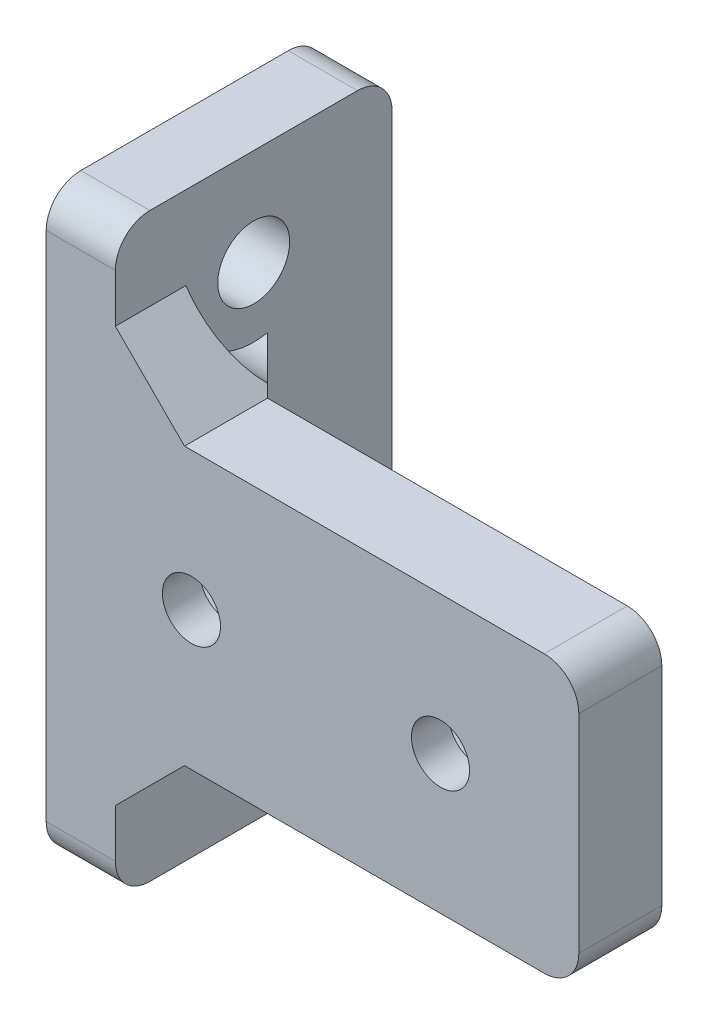
from build123d import *

# Parameters (mm, degrees)
SKETCH_1_W          = 38.5
SKETCH_1_H          = 20
EXTRUDE_1_DEPTH     = 6
SKETCH_2_W          = 20
SKETCH_2_H          = 42
EXTRUDE_2_DEPTH     = 5
SKETCH_3_R          = 2.1
CUT_EXTRUDE_1_DEPTH = 35.807506374
CUT_EXTRUDE_2_DEPTH = 3.3
SKETCH_5_R          = 2.6
CUT_EXTRUDE_3_DEPTH = 42.943414263
CHAMFER_2_SIZE      = 5
SKETCH_6_R          = 5
CUT_EXTRUDE_4_DEPTH = 42.943414263
FILLET_1_R          = 2.5


with BuildPart() as part:
    # Эскиз1 → Бобышка-Вытянуть1 (new body)
    with BuildSketch(Plane.XY):
        Rectangle(SKETCH_1_W, SKETCH_1_H)
    extrude(amount=EXTRUDE_1_DEPTH)

    # Эскиз2 → Бобышка-Вытянуть2 (add)
    with BuildSketch(Plane.ZY.offset(19.25)):
        with Locations((-4, 0)):
            Rectangle(SKETCH_2_W, SKETCH_2_H)
    extrude(amount=-EXTRUDE_2_DEPTH)

    # Эскиз3 → Вырез-Вытянуть1 (cut, through all)
    with BuildSketch(Plane.XY.offset(6)):
        with Locations((9.25, 0)):
            Circle(SKETCH_3_R)
        with Locations((-8.75, 0)):
            Circle(SKETCH_3_R)
    extrude(amount=-CUT_EXTRUDE_1_DEPTH, mode=Mode.SUBTRACT)

    # Эскиз4 → Вырез-Вытянуть2 (cut)
    with BuildSketch(Plane(origin=(0, 0, 0), x_dir=(-1, 0, 0), z_dir=(0, 0, -1))):
        Polygon((8.75, 4.041451884), (5.25, 2.020725942), (5.25, -2.020725942), (8.75, -4.041451884), (12.25, -2.020725942), (12.25, 2.020725942), align=None)
        Polygon((-9.25, 4.041451884), (-12.75, 2.020725942), (-12.75, -2.020725942), (-9.25, -4.041451884), (-5.75, -2.020725942), (-5.75, 2.020725942), align=None)
    extrude(amount=-CUT_EXTRUDE_2_DEPTH, mode=Mode.SUBTRACT)

    # Эскиз5 → Вырез-Вытянуть3 (cut, through all)
    with BuildSketch(Plane(origin=(-14.25, 0, 0), x_dir=(0, 0, -1), z_dir=(1, 0, 0))):
        with Locations((4, 14)):
            Circle(SKETCH_5_R)
        with Locations((4, -14)):
            Circle(SKETCH_5_R)
    extrude(amount=-CUT_EXTRUDE_3_DEPTH, mode=Mode.SUBTRACT)

    # Фаска2
    # the kernel refuses this chamfer: 5 mm, written as the material it adds along each edge
    with BuildSketch(Plane(origin=(-14.25, 10, -12.85841494), x_dir=(0, 1, 0), z_dir=(0, 0, 1))) as chamfer_2_piece_1_section:
        Polygon((CHAMFER_2_SIZE, 0), (0, -CHAMFER_2_SIZE), (0, 0), align=None)
    chamfer_2_piece_1 = extrude(amount=18.85841494, mode=Mode.PRIVATE)
    chamfer_2_piece_1 = chamfer_2_piece_1 - Plane(origin=(-14.25, 14, -4), x_dir=(0, 0, -1), z_dir=(1, 0, 0)) * Cylinder(2.6, 58, mode=Mode.PRIVATE)
    chamfer_2_piece_1 = split(chamfer_2_piece_1, bisect_by=Plane(origin=(-18.17920747, 10, -8.92920747), z_dir=(-0.7071067811865476, 0, 0.7071067811865476)), keep=Keep.TOP, mode=Mode.PRIVATE)
    add(chamfer_2_piece_1)
    with BuildSketch(Plane(origin=(-14.25, -10, 6), x_dir=(0, -1, 0), z_dir=(0, 0, -1))) as chamfer_2_piece_2_section:
        Polygon((CHAMFER_2_SIZE, 0), (0, -CHAMFER_2_SIZE), (0, 0), align=None)
    chamfer_2_piece_2 = extrude(amount=18.85841494, mode=Mode.PRIVATE)
    chamfer_2_piece_2 = chamfer_2_piece_2 - Plane(origin=(-14.25, -14, -4), x_dir=(0, 0, -1), z_dir=(1, 0, 0)) * Cylinder(2.6, 58, mode=Mode.PRIVATE)
    chamfer_2_piece_2 = split(chamfer_2_piece_2, bisect_by=Plane(origin=(-8.75, -10, 0.5), z_dir=(-0.7071067811865476, 0, 0.7071067811865476)), keep=Keep.TOP, mode=Mode.PRIVATE)
    add(chamfer_2_piece_2)
    with BuildSketch(Plane(origin=(-14.25, -22.85841494, 0), x_dir=(0, 0, -1), z_dir=(0, 1, 0))) as chamfer_2_piece_3_section:
        Polygon((CHAMFER_2_SIZE, 0), (0, -CHAMFER_2_SIZE), (0, 0), align=None)
    chamfer_2_piece_3 = extrude(amount=45.71682988, mode=Mode.PRIVATE)
    chamfer_2_piece_3 = chamfer_2_piece_3 - Plane(origin=(-14.25, -14, -4), x_dir=(0, 0, -1), z_dir=(1, 0, 0)) * Cylinder(2.6, 112, mode=Mode.PRIVATE)
    chamfer_2_piece_3 = split(chamfer_2_piece_3, bisect_by=Plane(origin=(-4.727015986, -6.364122788, 0), z_dir=(-0.5, -0.8660254037844387, 0)), keep=Keep.TOP, mode=Mode.PRIVATE)
    chamfer_2_piece_3 = split(chamfer_2_piece_3, bisect_by=Plane(origin=(-18.17920747, -18.92920747, 0), z_dir=(-0.7071067811865478, 0.7071067811865472, 0)), keep=Keep.TOP, mode=Mode.PRIVATE)
    add(chamfer_2_piece_3)
    with BuildSketch(Plane(origin=(-14.25, -22.85841494, 0), x_dir=(0, 0, -1), z_dir=(0, 1, 0))) as chamfer_2_piece_4_section:
        Polygon((CHAMFER_2_SIZE, 0), (0, -CHAMFER_2_SIZE), (0, 0), align=None)
    chamfer_2_piece_4 = extrude(amount=45.71682988, mode=Mode.PRIVATE)
    chamfer_2_piece_4 = chamfer_2_piece_4 - Plane(origin=(-14.25, 14, -4), x_dir=(0, 0, -1), z_dir=(1, 0, 0)) * Cylinder(2.6, 112, mode=Mode.PRIVATE)
    chamfer_2_piece_4 = split(chamfer_2_piece_4, bisect_by=Plane(origin=(-4.727015986, -6.364122788, 0), z_dir=(0.5, 0.8660254037844387, 0)), keep=Keep.TOP, mode=Mode.PRIVATE)
    chamfer_2_piece_4 = split(chamfer_2_piece_4, bisect_by=Plane(origin=(-12.25, -22.85841494, 0), z_dir=(-1, 0, 0)), keep=Keep.TOP, mode=Mode.PRIVATE)
    chamfer_2_piece_4 = split(chamfer_2_piece_4, bisect_by=Plane(origin=(4.67920747, -3.92920747, 0), z_dir=(-0.7071067811865476, -0.7071067811865476, 0)), keep=Keep.TOP, mode=Mode.PRIVATE)
    add(chamfer_2_piece_4)
    with BuildSketch(Plane(origin=(-14.25, -22.85841494, 0), x_dir=(0, 0, -1), z_dir=(0, 1, 0))) as chamfer_2_piece_5_section:
        Polygon((CHAMFER_2_SIZE, 0), (0, -CHAMFER_2_SIZE), (0, 0), align=None)
    chamfer_2_piece_5 = extrude(amount=45.71682988, mode=Mode.PRIVATE)
    chamfer_2_piece_5 = chamfer_2_piece_5 - Plane(origin=(-14.25, 14, -4), x_dir=(0, 0, -1), z_dir=(1, 0, 0)) * Cylinder(2.6, 112, mode=Mode.PRIVATE)
    chamfer_2_piece_5 = split(chamfer_2_piece_5, bisect_by=Plane(origin=(-24.522984014, -5.065084682, 0), z_dir=(-0.4999999999999998, 0.8660254037844388, 0)), keep=Keep.TOP, mode=Mode.PRIVATE)
    chamfer_2_piece_5 = split(chamfer_2_piece_5, bisect_by=Plane(origin=(4.67920747, -3.92920747, 0), z_dir=(-0.7071067811865476, -0.7071067811865476, 0)), keep=Keep.TOP, mode=Mode.PRIVATE)
    add(chamfer_2_piece_5)

    # Эскиз6 → Вырез-Вытянуть4 (cut, through all)
    with BuildSketch(Plane(origin=(-14.25, 0, 0), x_dir=(0, 0, -1), z_dir=(1, 0, 0))):
        with Locations((4, -14)):
            Circle(SKETCH_6_R)
        with Locations((4, 14)):
            Circle(SKETCH_6_R)
    extrude(amount=CUT_EXTRUDE_4_DEPTH, mode=Mode.SUBTRACT)

    # Скругление1
    fillet_1_edges = [part.edges().sort_by_distance(p)[0] for p in [
        (-16.75, 21, 6),
        (-16.75, -21, 6),
        (-16.75, -21, -14),
        (-16.75, 21, -14),
        (19.25, 10, 3),
        (19.25, -10, 3),
    ]]
    fillet(fillet_1_edges, radius=FILLET_1_R)


solid = part.part
